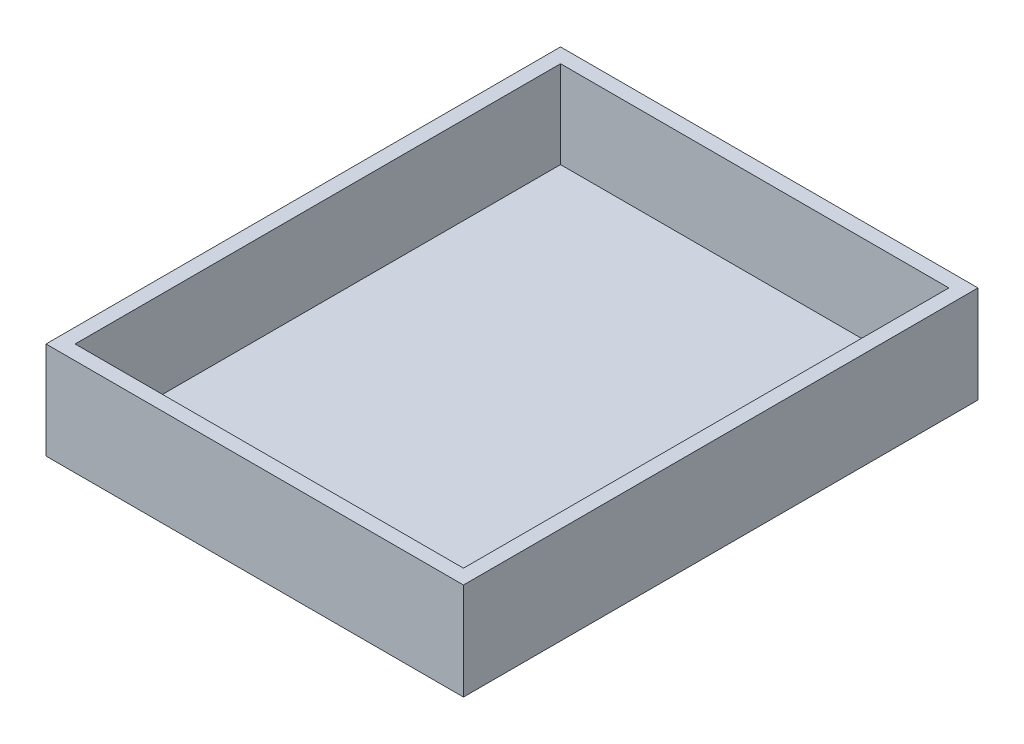
from build123d import *

# Parameters (mm, degrees)
SKETCH1_W          = 101.6
SKETCH1_H          = 127
BASE_EXTRUDE_DEPTH = 2.54
SKETCH2_W          = 109.22
SKETCH2_H          = 134.62
SKETCH2_W_2        = 101.6
SKETCH2_H_2        = 127
WALLS_DEPTH        = 25.4


with BuildPart() as part:
    # Sketch1 → Base Extrude (new body)
    with BuildSketch(Plane(origin=(0, 0, 0), x_dir=(1, 0, 0), z_dir=(0, 1, 0))):
        with Locations((50.8, 63.5)):
            Rectangle(SKETCH1_W, SKETCH1_H)
    extrude(amount=BASE_EXTRUDE_DEPTH)

    # Sketch2 → Walls (add)
    with BuildSketch(Plane.XZ):
        with Locations((50.8, -63.5)):
            Rectangle(SKETCH2_W, SKETCH2_H)
        with Locations((50.8, -63.5)):
            Rectangle(SKETCH2_W_2, SKETCH2_H_2, mode=Mode.SUBTRACT)
    extrude(amount=-WALLS_DEPTH)


solid = part.part
